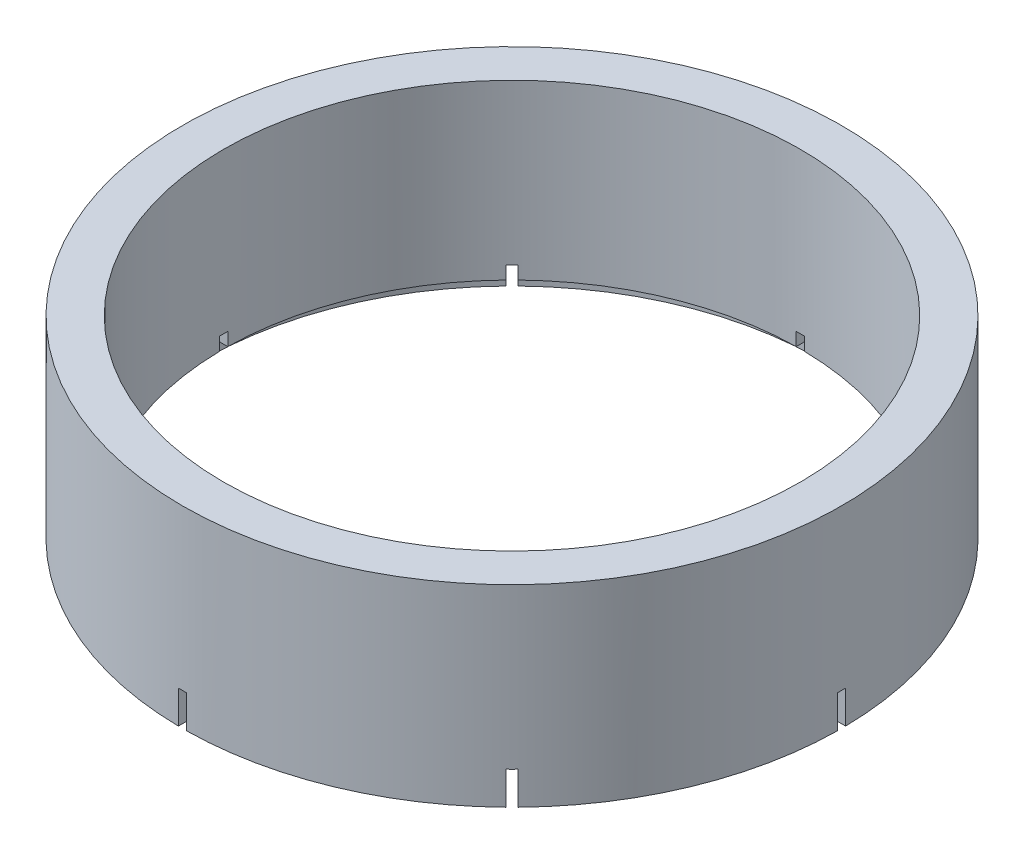
from build123d import *

# Parameters (mm, degrees)
SKETCH1_R           = 40
SKETCH1_R_2         = 35
BOSS_EXTRUDE1_DEPTH = 25.4
SKETCH2_R           = 37.5
SKETCH2_R_2         = 35
CUT_EXTRUDE1_DEPTH  = 4.4
SKETCH3_W           = 1
SKETCH3_H           = 6
CUT_EXTRUDE2_DEPTH  = 63.009354133
CIRPATTERN1_COUNT   = 4
CIRPATTERN1_ANGLE   = 135
SKETCH4_R           = 45.877575429
CUT_EXTRUDE3_DEPTH  = 2


with BuildPart() as part:
    # Sketch1 → Boss-Extrude1 (new body)
    with BuildSketch(Plane(origin=(0, 0, 0), x_dir=(1, 0, 0), z_dir=(0, 1, 0))):
        Circle(SKETCH1_R)
        Circle(SKETCH1_R_2, mode=Mode.SUBTRACT)
    extrude(amount=BOSS_EXTRUDE1_DEPTH)

    # Sketch2 → Cut-Extrude1 (cut)
    with BuildSketch(Plane.XZ):
        Circle(SKETCH2_R)
        Circle(SKETCH2_R_2, mode=Mode.SUBTRACT)
    extrude(amount=-CUT_EXTRUDE1_DEPTH, mode=Mode.SUBTRACT)

    # Sketch3 → Cut-Extrude2 (cut, symmetric)
    with BuildSketch(Plane.XY):
        with Locations((0, 3)):
            Rectangle(SKETCH3_W, SKETCH3_H)
    cut_extrude2 = extrude(amount=CUT_EXTRUDE2_DEPTH, both=True, mode=Mode.SUBTRACT)

    # CirPattern1: Cut-Extrude2 ×4 about axis
    cirpattern1_axis = Axis((0, 25.4, 0), (0, 1, 0))
    for i in range(1, CIRPATTERN1_COUNT):
        add(cut_extrude2.rotate(cirpattern1_axis, i * CIRPATTERN1_ANGLE / (CIRPATTERN1_COUNT - 1)), mode=Mode.SUBTRACT)

    # Sketch4 → Cut-Extrude3 (cut)
    with BuildSketch(Plane.XZ):
        Circle(SKETCH4_R)
    extrude(amount=-CUT_EXTRUDE3_DEPTH, mode=Mode.SUBTRACT)


solid = part.part
